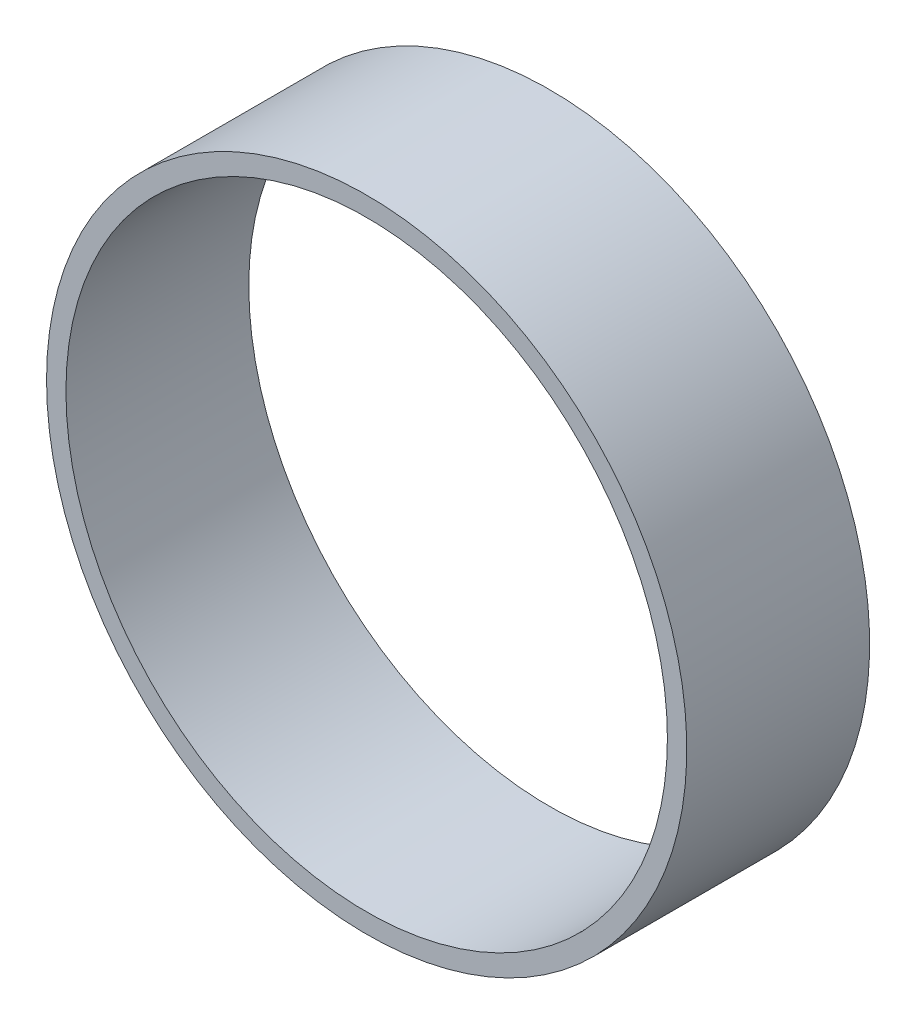
from build123d import *

# Parameters (mm, degrees)
SKETCH1_W          = 47.15
SKETCH1_H          = 5
SKETCH2_R          = 8.5
CUT_EXTRUDE1_DEPTH = 127.283124367
CIRPATTERN1_COUNT  = 20


with BuildPart() as part:
    # Sketch1 → Revolve1 (revolve)
    with BuildSketch(Plane(origin=(0, 0, 0), x_dir=(0, 0, -1), z_dir=(1, 0, 0))):
        with Locations((24.575, 80.05)):
            Rectangle(SKETCH1_W, SKETCH1_H)
    revolve(axis=Axis((0, 0, -50.5075), (0, 0, 1)))

    # Sketch2 → Cut-Extrude1 (cut, through all)
    with BuildSketch(Plane(origin=(0, 0, 0), x_dir=(0, 0, -1), z_dir=(1, 0, 0))):
        with Locations((14.309765987, 6.214899086)):
            Circle(SKETCH2_R)
        with Locations((34.840234013, -6.214899086)):
            Circle(SKETCH2_R)
    extrude(amount=-CUT_EXTRUDE1_DEPTH, mode=Mode.SUBTRACT)

    # CirPattern1: part ×20 about axis
    cirpattern1_axis = Axis((0, 0, -50.5075), (0, 0, 1))


with BuildPart() as part_1:
    add(part.part)
    for i in range(1, CIRPATTERN1_COUNT):
        add(part.part.rotate(cirpattern1_axis, i * 360 / CIRPATTERN1_COUNT))


solid = part_1.part
